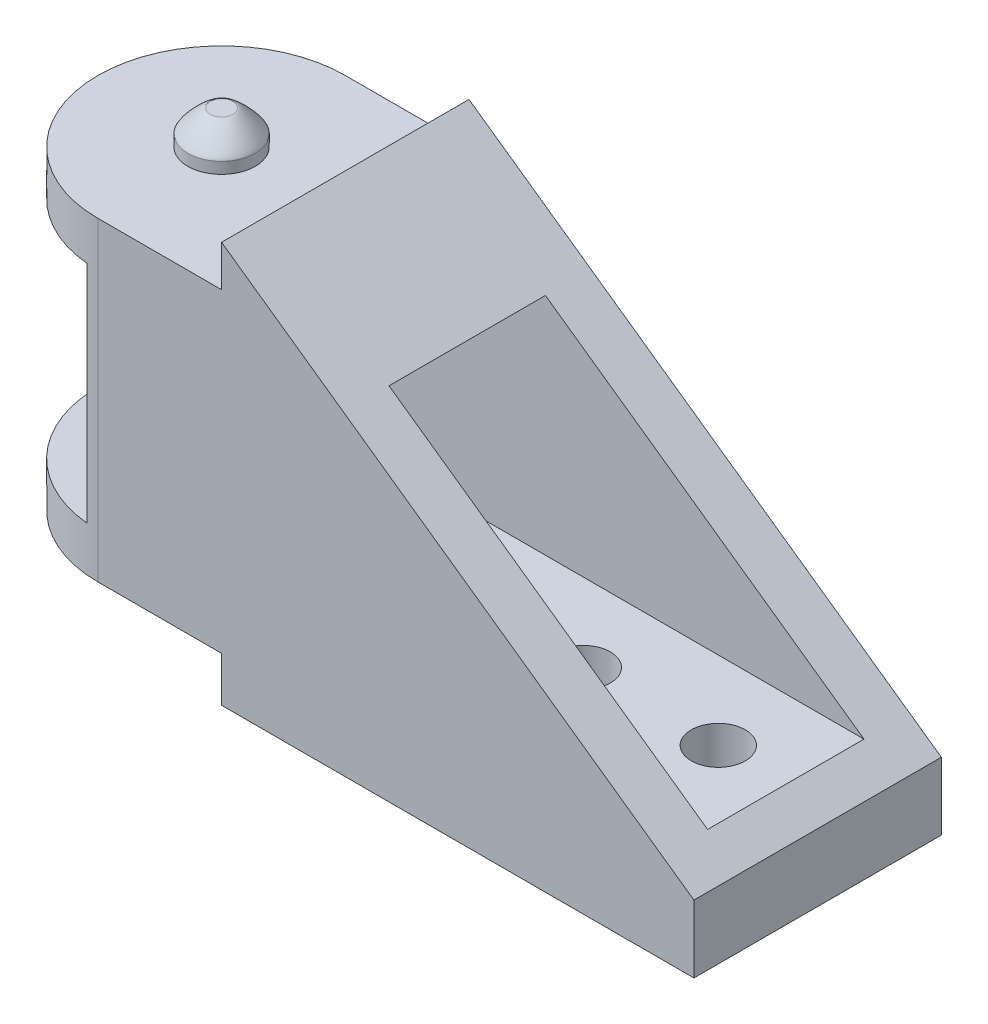
from build123d import *

# Parameters (mm, degrees)
SALIENTE_EXTRUIR1_DEPTH = 11
CORTAR_EXTRUIR1_DEPTH   = 61
CROQUIS3_W              = 6.95445115
CROQUIS3_H              = 10
CORTAR_EXTRUIR2_DEPTH   = 61
CROQUIS4_R              = 1.2
CORTAR_EXTRUIR3_DEPTH   = 61
CROQUIS5_R              = 1.5
SALIENTE_EXTRUIR2_DEPTH = 1.5
REDONDEO2_SIZE          = 1
REDONDEO6_SIZE          = 1
CROQUIS6_W              = 1
CROQUIS6_H              = 11
CORTAR_EXTRUIR4_DEPTH   = 2
CROQUIS7_W              = 1
CROQUIS7_H              = 11
CORTAR_EXTRUIR5_DEPTH   = 2


with BuildPart() as part:
    # Croquis1 → Saliente-Extruir1 (new body)
    with BuildSketch(Plane.XY):
        Polygon((-5, 7), (5, 7), (5, 9), (5.755229402, 9), (27, -6), (27, -9), (5, -9), (5, -7), (-5, -7), (-5, -5), (0, -5), (0, 5), (-5, 5), align=None)
    extrude(amount=SALIENTE_EXTRUIR1_DEPTH)

    # Croquis2 → Cortar-Extruir1 (cut)
    with BuildSketch(Plane.XZ.offset(7)):
        with BuildLine():
            ThreePointArc((-5, 5.5), (-3.389087297, 9.389087297), (0.5, 11))
            Line((0.5, 11), (-5, 11))
            Line((-5, 11), (-5, 5.5))
        make_face()
        with BuildLine():
            ThreePointArc((0.5, 0), (-3.389087297, 1.610912703), (-5, 5.5))
            Line((-5, 5.5), (-5, 0))
            Line((-5, 0), (0.5, 0))
        make_face()
    extrude(amount=-CORTAR_EXTRUIR1_DEPTH, mode=Mode.SUBTRACT)

    # Croquis3 → Cortar-Extruir2 (cut)
    with BuildSketch(Plane.ZY):
        with Locations((5.5, 0)):
            Rectangle(CROQUIS3_W, CROQUIS3_H)
    extrude(amount=-CORTAR_EXTRUIR2_DEPTH, mode=Mode.SUBTRACT)

    # Croquis4 → Cortar-Extruir3 (cut)
    with BuildSketch(Plane(origin=(0, -5, 0), x_dir=(1, 0, 0), z_dir=(0, 1, 0))):
        with Locations(Location((22.58368196, -5.5, 0), (0, 0, 270))):
            Circle(CROQUIS4_R)
        with Locations(Location((16.58368196, -5.5, 0), (0, 0, 270))):
            Circle(CROQUIS4_R)
    extrude(amount=-CORTAR_EXTRUIR3_DEPTH, mode=Mode.SUBTRACT)

    # Croquis5 → Saliente-Extruir2 (add)
    with BuildSketch(Plane(origin=(0, 7, 0), x_dir=(1, 0, 0), z_dir=(0, 1, 0))):
        with Locations((0.5, -5.5)):
            Circle(CROQUIS5_R)
    saliente_extruir2 = extrude(amount=SALIENTE_EXTRUIR2_DEPTH)

    # Simetría4: Saliente-Extruir2 across plane
    add(saliente_extruir2.mirror(Plane.ZX))

    # Redondeo2
    # a fillet whose section is not a circle: 1 mm, written as the material it takes off along each edge
    with BuildSketch(Plane(origin=(0.5, 8.5, 5.5), x_dir=(1, 0, 0), z_dir=(0, 0, 1))) as redondeo2_piece_1:
        with BuildLine():
            Bezier((1.5, -REDONDEO2_SIZE), (1.5, 0), (1.5 - REDONDEO2_SIZE, 0), weights=[1, 0.141421356, 1])
            Line((1.5 - REDONDEO2_SIZE, 0), (1.5, 0))
            Line((1.5, 0), (1.5, -REDONDEO2_SIZE))
        make_face()
    revolve(axis=Axis((0.5, 8.5, 5.5), (0, 1, 0)), mode=Mode.SUBTRACT)

    # Redondeo6
    # a fillet whose section is not a circle: 1 mm, written as the material it takes off along each edge
    with BuildSketch(Plane(origin=(0.5, -8.5, 5.5), x_dir=(1, 0, 0), z_dir=(0, 0, 1))) as redondeo6_piece_1:
        with BuildLine():
            Bezier((1.5, REDONDEO6_SIZE), (1.5, 0), (1.5 - REDONDEO6_SIZE, 0), weights=[1, 0.141421356, 1])
            Line((1.5 - REDONDEO6_SIZE, 0), (1.5, 0))
            Line((1.5, 0), (1.5, REDONDEO6_SIZE))
        make_face()
    revolve(axis=Axis((0.5, -8.5, 5.5), (0, 1, 0)), mode=Mode.SUBTRACT)

    # Croquis6 → Cortar-Extruir4 (cut)
    with BuildSketch(Plane(origin=(0, 9, 0), x_dir=(1, 0, 0), z_dir=(0, 1, 0))):
        with Locations((5.5, -5.5)):
            Rectangle(CROQUIS6_W, CROQUIS6_H)
    extrude(amount=-CORTAR_EXTRUIR4_DEPTH, mode=Mode.SUBTRACT)

    # Croquis7 → Cortar-Extruir5 (cut)
    with BuildSketch(Plane.XZ.offset(9)):
        with Locations((5.5, 5.5)):
            Rectangle(CROQUIS7_W, CROQUIS7_H)
    extrude(amount=-CORTAR_EXTRUIR5_DEPTH, mode=Mode.SUBTRACT)


solid = part.part
